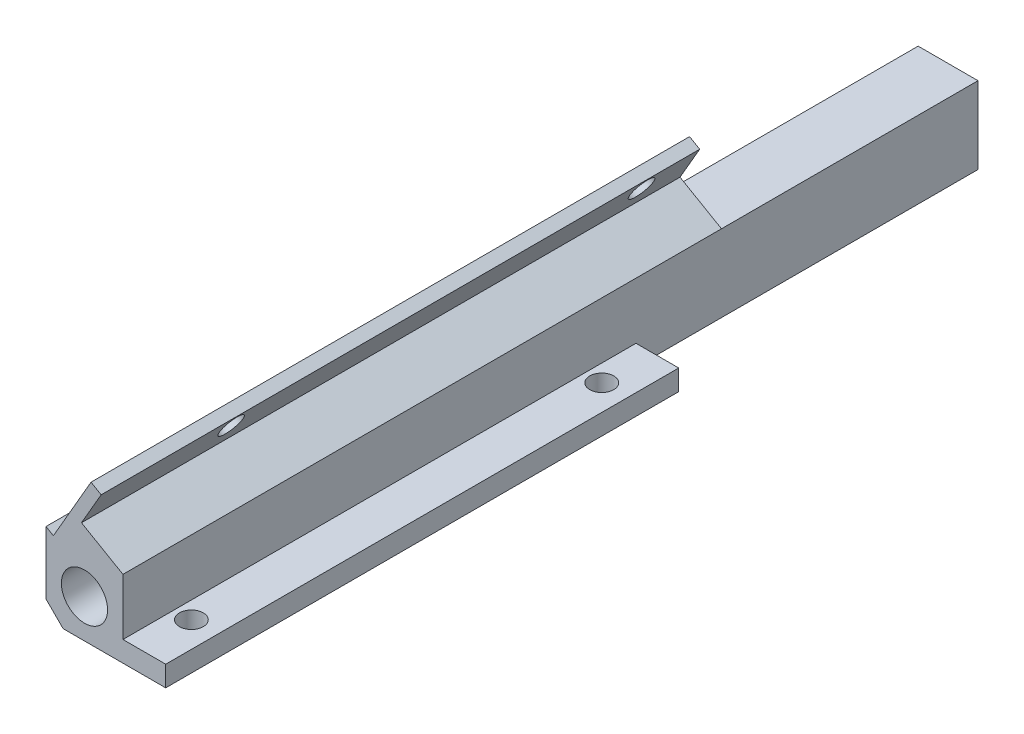
from build123d import *

# Parameters (mm, degrees)
SKETCH1_W           = 77.47
SKETCH1_H           = 127
BOSS_EXTRUDE1_DEPTH = 11.43
SKETCH2_R           = 3.429
CUT_EXTRUDE1_DEPTH  = 150.202030147
CUT_EXTRUDE2_DEPTH  = 150.202030147
SKETCH4_W           = 54.61
SKETCH4_H           = 6.35
CUT_EXTRUDE3_DEPTH  = 150.202030147
CHAMFER1_SIZE       = 2.54
CUT_EXTRUDE4_DEPTH  = 150.202030147
SKETCH6_W           = 53.34
SKETCH6_H           = 76.2
CUT_EXTRUDE5_DEPTH  = 150.202030147
SKETCH7_R           = 1.778
HOLE_CUTS_1_DEPTH   = 130.427892666
BOSS_EXTRUDE5_DEPTH = 88.9
SKETCH18_W          = 6.35
SKETCH18_H          = 5.08
CUT_EXTRUDE13_DEPTH = 76.2
HOLE_CUTS_2_REACH   = 132.131
SKETCH19_R          = 1.778
SKETCH20_W          = 88.9
SKETCH20_H          = 11.176
CUT_EXTRUDE16_DEPTH = 1.27
SKETCH21_W          = 88.9
SKETCH21_H          = 5.842
CUT_EXTRUDE17_DEPTH = 0.762
SKETCH22_W          = 6.35
SKETCH22_H          = 76.2
CUT_EXTRUDE18_DEPTH = 2.032


with BuildPart() as part:
    # Sketch1 → Boss-Extrude1 (new body)
    with BuildSketch(Plane(origin=(0, 0, 0), x_dir=(1, 0, 0), z_dir=(0, 1, 0))):
        with Locations((38.735, 63.5)):
            Rectangle(SKETCH1_W, SKETCH1_H)
    extrude(amount=BOSS_EXTRUDE1_DEPTH)

    # Sketch2 → Cut-Extrude1 (cut, through all)
    with BuildSketch(Plane.XY):
        with Locations((5.715, 5.715)):
            Circle(SKETCH2_R)
        with Locations((71.755, 5.715)):
            Circle(SKETCH2_R)
    extrude(amount=-CUT_EXTRUDE1_DEPTH, mode=Mode.SUBTRACT)

    # Sketch3 → Cut-Extrude2 (cut, through all)
    with BuildSketch(Plane(origin=(0, 11.43, 0), x_dir=(1, 0, 0), z_dir=(0, 1, 0))):
        with BuildLine():
            Line((11.43, 127), (11.43, 88.9))
            ThreePointArc((11.43, 88.9), (15.149743879, 79.919743879), (24.13, 76.2))
            Line((24.13, 76.2), (53.34, 76.2))
            ThreePointArc((53.34, 76.2), (62.320256121, 79.919743879), (66.04, 88.9))
            Line((66.04, 88.9), (66.04, 127))
            Line((66.04, 127), (11.43, 127))
        make_face()
    extrude(amount=-CUT_EXTRUDE2_DEPTH, mode=Mode.SUBTRACT)

    # Sketch4 → Cut-Extrude3 (cut, through all)
    with BuildSketch(Plane(origin=(0, 0, -127), x_dir=(-1, 0, 0), z_dir=(0, 0, -1))):
        with Locations((-38.735, 8.255)):
            Rectangle(SKETCH4_W, SKETCH4_H)
    extrude(amount=-CUT_EXTRUDE3_DEPTH, mode=Mode.SUBTRACT)

    # Chamfer1
    chamfer1_edges = [part.edges().sort_by_distance(p)[0] for p in [
        (0, 0, -63.5),
        (0, 11.43, -63.5),
        (77.47, 0, -63.5),
        (77.47, 11.43, -63.5),
    ]]
    chamfer(chamfer1_edges, length=CHAMFER1_SIZE)

    # Sketch5 → Cut-Extrude4 (cut, through all)
    with BuildSketch(Plane(origin=(0, 11.43, 0), x_dir=(1, 0, 0), z_dir=(0, 1, 0))):
        Polygon((11.43, 88.9), (11.43, 76.2), (77.47, 76.2), (77.47, 127), (11.43, 127), align=None)
    extrude(amount=-CUT_EXTRUDE4_DEPTH, mode=Mode.SUBTRACT)

    # Sketch6 → Cut-Extrude5 (cut, through all)
    with BuildSketch(Plane(origin=(0, 11.43, 0), x_dir=(1, 0, 0), z_dir=(0, 1, 0))):
        with Locations((50.8, 38.1)):
            Rectangle(SKETCH6_W, SKETCH6_H)
    extrude(amount=-CUT_EXTRUDE5_DEPTH, mode=Mode.SUBTRACT)

    # Sketch7 → Hole Cuts 1 (cut, through all)
    with BuildSketch(Plane(origin=(0, 5.08, 0), x_dir=(1, 0, 0), z_dir=(0, 1, 0))):
        with Locations((13.97, 68.58)):
            Circle(SKETCH7_R)
        with Locations((13.97, 7.62)):
            Circle(SKETCH7_R)
    extrude(amount=-HOLE_CUTS_1_DEPTH, mode=Mode.SUBTRACT)

    # Sketch17 → Boss-Extrude5 (add)
    with BuildSketch(Plane.XY):
        Polygon((0, 8.89), (0, 11.869940905), (5.588, 21.548640818), (8.851738686, 19.664320409), (5.930738686, 14.605), (11.43, 11.43), (2.54, 11.43), align=None)
    extrude(amount=-BOSS_EXTRUDE5_DEPTH)

    # Sketch18 → Cut-Extrude13 (cut)
    with BuildSketch(Plane.XY):
        with Locations((20.955, 2.54)):
            Rectangle(SKETCH18_W, SKETCH18_H)
    extrude(amount=-CUT_EXTRUDE13_DEPTH, mode=Mode.SUBTRACT)

    # Sketch19 → Hole Cuts 2 (cut, up to next)
    with BuildSketch(Plane(origin=(-1.876096497, 1.083164817, 0), x_dir=(0, 0, -1), z_dir=(0.8660254037844362, -0.5000000000000042, 0)), mode=Mode.PRIVATE) as hole_cuts_2_sk1:
        with Locations((20.32, 19.423670365)):
            Circle(SKETCH19_R)
    hole_cuts_2_tool1 = extrude(hole_cuts_2_sk1.sketch, amount=-HOLE_CUTS_2_REACH, mode=Mode.PRIVATE) & part.part
    # Sketch19 → Hole Cuts 2 (cut, up to next)
    with BuildSketch(Plane(origin=(-1.876096497, 1.083164817, 0), x_dir=(0, 0, -1), z_dir=(0.8660254037844362, -0.5000000000000042, 0)), mode=Mode.PRIVATE) as hole_cuts_2_sk2:
        with Locations((81.28, 19.423670365)):
            Circle(SKETCH19_R)
    hole_cuts_2_tool2 = extrude(hole_cuts_2_sk2.sketch, amount=-HOLE_CUTS_2_REACH, mode=Mode.PRIVATE) & part.part
    add(hole_cuts_2_tool1.solids().sort_by_distance((7.835739, 17.904557, -20.32))[0], mode=Mode.SUBTRACT)
    add(hole_cuts_2_tool2.solids().sort_by_distance((7.835739, 17.904557, -81.28))[0], mode=Mode.SUBTRACT)

    # Sketch20 → Cut-Extrude16 (cut)
    with BuildSketch(Plane(origin=(-5.139835183, 2.967485226, 0), x_dir=(0, 0, 1), z_dir=(-0.8660254037844362, 0.5000000000000042, 0))):
        with Locations((-44.45, 15.867670365)):
            Rectangle(SKETCH20_W, SKETCH20_H)
    extrude(amount=-CUT_EXTRUDE16_DEPTH, mode=Mode.SUBTRACT)

    # Sketch21 → Cut-Extrude17 (cut)
    with BuildSketch(Plane(origin=(-1.876096497, 1.083164817, 0), x_dir=(0, 0, -1), z_dir=(0.8660254037844366, -0.5000000000000037, 0))):
        with Locations((44.45, 18.534670365)):
            Rectangle(SKETCH21_W, SKETCH21_H)
    extrude(amount=-CUT_EXTRUDE17_DEPTH, mode=Mode.SUBTRACT)

    # Sketch22 → Cut-Extrude18 (cut)
    with BuildSketch(Plane(origin=(0, 5.08, 0), x_dir=(1, 0, 0), z_dir=(0, 1, 0))):
        with Locations((14.605, 38.1)):
            Rectangle(SKETCH22_W, SKETCH22_H)
    extrude(amount=-CUT_EXTRUDE18_DEPTH, mode=Mode.SUBTRACT)


solid = part.part
